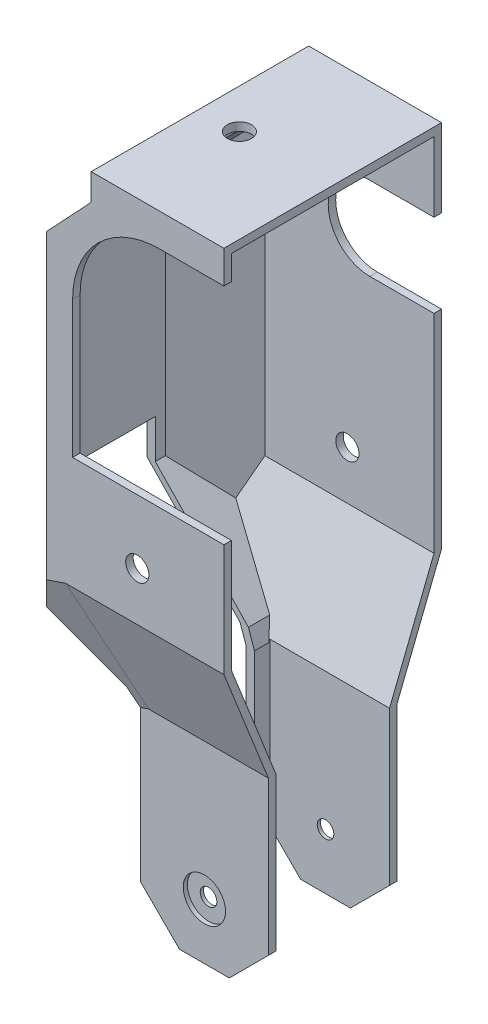
from build123d import *
from build123d.topology import SkipClean

# Parameters (mm, degrees)
EXTRUDE_1_DEPTH      = 1
SKETCH_2_W           = 14.000000000000007
SKETCH_2_H           = 24.219999999999995
SKETCH_2_R           = 1.45
SKETCH_2_H_2         = 1
EXTRUDE_2_DEPTH      = 1
SKETCH_3_R           = 1.4
CUT_EXTRUDE_1_DEPTH  = 50.06098246060713
EXTRUDE_3_DEPTH      = 25.22
EXTRUDE_4_DEPTH      = 1
CUT_EXTRUDE_2_DEPTH  = 0.1
EXTRUDE_5_REACH      = 56.514
EXTRUDE_6_DEPTH      = 4.7
EXTRUDE_7_DEPTH      = 6.26
CUT_EXTRUDE_3_DEPTH  = 54.61414092494707
CUT_EXTRUDE_4_REACH  = 50.47
EXTRUDE_8_REACH      = 53.244
CUT_EXTRUDE_6_DEPTH  = 0.721269738
SKETCH_15_R          = 1.000000000000005
EXTRUDE_9_DEPTH      = 1
EXTRUDE_START        = -1
EXTRUDE_10_DEPTH     = 1
CUT_EXTRUDE_7_DEPTH  = 0.1
CUT_EXTRUDE_10_REACH = 56.514
CUT_EXTRUDE_12_DEPTH = 51.10000000000001
EXTRUDE_START_2      = -2.75
EXTRUDE_11_DEPTH     = 2.75
CUT_EXTRUDE_13_REACH = 49.777
CUT_EXTRUDE_14_REACH = 49.777
EXTRUDE_12_DEPTH     = 2.75
EXTRUDE_13_REACH     = 50.829
CUT_EXTRUDE_15_REACH = 49.777
EXTRUDE_START_3      = -2.81831
EXTRUDE_14_DEPTH     = 2.81831
CUT_EXTRUDE_START    = -0.75
CUT_EXTRUDE_16_DEPTH = 0.75
CHAMFER_1_SIZE       = 0.8
CHAMFER_3_SIZE       = 6
EXTRUDE_15_DEPTH     = 1
EXTRUDE_16_DEPTH     = 1
CUT_EXTRUDE_17_DEPTH = 1
SKETCH_36_R          = 1.4000000000000001
CUT_EXTRUDE_18_DEPTH = 1
EXTRUDE_17_DEPTH     = 0.9
CUT_EXTRUDE_START_2  = -12.11
SKETCH_40_W          = 89.84282301383726
SKETCH_40_H          = 107.72029223205328
CUT_EXTRUDE_20_DEPTH = 12.11
CUT_EXTRUDE_22_DEPTH = 13.11
SKETCH_42_R          = 2.549999999999999
SKETCH_42_R_2        = 1.000000000000005
CUT_EXTRUDE_23_DEPTH = 0.5
CUT_EXTRUDE_START_3  = -0.5
SKETCH_43_R          = 2.549999999999998
CUT_EXTRUDE_24_DEPTH = 0.5


with BuildPart() as part:
    # 草图1 → 凸台-拉伸1 (new body)
    with BuildSketch(Plane.XY):
        with BuildLine():
            ThreePointArc((2.305000000000004, 21.64000000000001), (-2.7099999999999955, 26.655000000000012), (2.3050000000000055, 31.670000000000012))
            Line((2.305000000000005, 31.670000000000012), (9.040000000000003, 31.670000000000012))
            Line((9.040000000000003, 31.670000000000012), (9.040000000000003, 40.10000000000001))
            Line((9.040000000000003, 40.10000000000001), (-4.960000000000004, 40.10000000000001))
            Line((-4.960000000000004, 40.10000000000001), (-4.960000000000003, 37.50000000000002))
            Line((-4.960000000000003, 37.50000000000002), (-9.039999999999996, 33.15000000000001))
            Line((-9.039999999999996, 33.15000000000001), (-9.04, -3.3999999999999915))
            Line((-9.04, -3.3999999999999932), (9.040000000000003, -3.3999999999999932))
            Line((9.040000000000003, -3.3999999999999932), (9.040000000000003, 6.670384958363659))
            Line((9.040000000000003, 6.670384958363659), (9.040000000000003, 21.640000000000015))
            Line((9.040000000000003, 21.640000000000015), (2.305000000000005, 21.640000000000015))
        make_face()
    extrude(amount=EXTRUDE_1_DEPTH)

    # 草图2 → 凸台-拉伸2 (add)
    # profile 1 of 2: a face of its own
    with BuildSketch(Plane(origin=(0, 40.10000000000001, 0), x_dir=(1, 0, 0), z_dir=(0, 1, 0))):
        with Locations((2.039999999999999, 12.109999999999998)):
            Rectangle(SKETCH_2_W, SKETCH_2_H)
        with Locations(Location((-1.1999999999999935, 12.11, 0), (0, 0, 270))):
            Circle(SKETCH_2_R, mode=Mode.SUBTRACT)
    # profile 2 of 2: a face of its own
    with BuildSketch(Plane(origin=(0, 40.10000000000001, 0), x_dir=(1, 0, 0), z_dir=(0, 1, 0))):
        with Locations((2.039999999999999, -0.5)):
            Rectangle(SKETCH_2_W, SKETCH_2_H_2)
    extrude(amount=EXTRUDE_2_DEPTH)

    # 草图3 → 切除-拉伸1 (cut, through all)
    with BuildSketch(Plane.XY.offset(1)):
        with Locations((0.9999999999999981, 2.460000000000012)):
            Circle(SKETCH_3_R)
    extrude(amount=-CUT_EXTRUDE_1_DEPTH, mode=Mode.SUBTRACT)

    # 草图4 → 凸台-拉伸3 (add)
    with BuildSketch(Plane.XY.offset(1)):
        Polygon((-15.939999999999996, 25.793382352941165), (-15.939999999999996, 27.255138921743242), (-17.339999999999993, 25.762491862919703), (-17.339999999999996, 24.30073529411763), (-16.33999999999999, 25.366911764705875), align=None)
        Polygon((-16.33999999999999, 25.366911764705875), (-17.339999999999996, 24.30073529411763), (-17.339999999999996, 24.20000000000001), (-17.339999999999993, 1.3000000000000078), (-16.339999999999996, 1.3000000000000096), (-16.339999999999996, 24.20000000000001), align=None)
        Polygon((-4.960000000000004, 41.10000000000001), (-5.960000000000004, 41.10000000000001), (-5.960000000000004, 37.89558009821385), (-9.769380317724162, 33.834108435934404), (-15.93999999999999, 27.25513892174324), (-15.939999999999996, 25.793382352941165), (-9.039999999999996, 33.15000000000001), (-4.960000000000003, 37.50000000000002), align=None)
    extrude(amount=-EXTRUDE_3_DEPTH)

    # 草图5 → 凸台-拉伸4 (add)
    with BuildSketch(Plane.XY.offset(1)):
        Polygon((-16.339999999999993, 25.36691176470587), (-16.339999999999996, 1.3000000000000096), (-9.039999999999997, 1.3000000000000165), (-9.039999999999994, 33.15000000000001), align=None)
    extrude(amount=-EXTRUDE_4_DEPTH)

    # 草图6 → 切除-拉伸2 (cut)
    with BuildSketch(Plane(origin=(0, 0, 0), x_dir=(-1, 0, 0), z_dir=(0, 0, -1))):
        with BuildLine():
            Line((-2.305000000000006, 21.640000000000015), (-9.040000000000003, 21.640000000000015))
            Line((-9.040000000000003, 21.640000000000015), (-9.040000000000003, -3.3999999999999932))
            Line((-9.040000000000003, -3.3999999999999932), (9.04, -3.3999999999999932))
            Line((9.04, -3.3999999999999932), (9.04, 1.300000000000013))
            Line((9.04, 1.300000000000013), (16.339999999999996, 1.3000000000000096))
            Line((16.339999999999996, 1.3000000000000096), (16.339999999999993, 25.36691176470587))
            Line((16.339999999999993, 25.36691176470587), (4.959999999999999, 37.50000000000002))
            Line((4.959999999999999, 37.50000000000002), (4.960000000000004, 40.10000000000001))
            Line((4.960000000000004, 40.10000000000001), (-9.040000000000003, 40.10000000000001))
            Line((-9.040000000000003, 40.10000000000001), (-9.040000000000003, 31.670000000000012))
            Line((-9.040000000000003, 31.670000000000012), (-2.3050000000000046, 31.670000000000012))
            ThreePointArc((-2.3050000000000046, 31.670000000000012), (2.709999999999992, 26.655000000000012), (-2.305000000000006, 21.640000000000015))
        make_face()
    extrude(amount=-CUT_EXTRUDE_2_DEPTH, mode=Mode.SUBTRACT)

    # 凸台-拉伸5: up to this plane
    extrude_5_end = Plane(origin=(-9.127141339001065, -3.147290116896902, 0), z_dir=(0.9453729816262727, 0.3259906833194027, 0))
    # 草图7 → 凸台-拉伸5 (add, up to the surface)
    with BuildSketch(Plane(origin=(9.040000000000003, 0, 0), x_dir=(0, 0, -1), z_dir=(1, 0, 0)), mode=Mode.PRIVATE) as extrude_5_sk1:
        Polygon((-1, -3.3999999999999932), (4.359999999999999, -16.885), (5.26, -16.885), (-0.1, -3.3999999999999932), align=None)
    extrude_5_tool1 = split(extrude(extrude_5_sk1.sketch, amount=-EXTRUDE_5_REACH, mode=Mode.PRIVATE), bisect_by=extrude_5_end, keep=Keep.BOTH, mode=Mode.PRIVATE)
    add(extrude_5_tool1.solids().sort_by_distance((9.04, -10.1425, -2.13))[0])

    # 草图8 → 凸台-拉伸6 (add)
    with BuildSketch(Plane.XZ.offset(-1.300000000000013)):
        Polygon((-16.339999999999996, -24.22), (-16.339999999999996, 0.1), (-9.04, 0.10000000000000286), (-9.04, 1), (-17.339999999999993, 1), (-17.340000000000046, -24.22), align=None)
    extrude(amount=EXTRUDE_6_DEPTH)

    # 草图9 → 凸台-拉伸7 (add)
    with BuildSketch(Plane.XY.offset(1)):
        Polygon((-17.339999999999993, -3.399999999999995), (-4.390000000000023, -16.885), (-9.039999999999997, -3.3999999999999932), align=None)
    extrude(amount=-EXTRUDE_7_DEPTH)

    # 草图10 → 切除-拉伸3 (cut, through all)
    with BuildSketch(Plane(origin=(-9.127141339001064, -3.1472901168968996, 0), x_dir=(0, 0, -1), z_dir=(0.9453729816262728, 0.3259906833194025, 0))):
        Polygon((-1, -14.531523694987438), (4.359999999999999, -14.531523694987433), (-1, -0.2673123603219238), align=None)
    extrude(amount=-CUT_EXTRUDE_3_DEPTH, mode=Mode.SUBTRACT)

    # 切除-拉伸4: up to this face of the body (flat: up to its plane)
    cut_extrude_4_end = Plane(part.part.faces().sort_by_distance((1.105315773, -9.810831482, -2.448168835))[0])
    # 草图11 → 切除-拉伸4 (cut, up to the picked face)
    with BuildSketch(Plane(origin=(0, 0, -5.260000000000001), x_dir=(-1, 0, 0), z_dir=(0, 0, -1)), mode=Mode.PRIVATE) as cut_extrude_4_sk1:
        Polygon((4.390000000000023, -16.885000000000005), (17.340000000000007, -3.399999999999995), (16.339999999999996, -3.399999999999995), (9.039999999999997, -3.3999999999999932), align=None)
    cut_extrude_4_tool1 = split(extrude(cut_extrude_4_sk1.sketch, amount=-CUT_EXTRUDE_4_REACH, mode=Mode.PRIVATE), bisect_by=cut_extrude_4_end, keep=Keep.BOTH, mode=Mode.PRIVATE)
    add(cut_extrude_4_tool1.solids().sort_by(Axis((-10.256667, -7.895, -5.26), (0, 0, 1)))[0], mode=Mode.SUBTRACT)

    # 凸台-拉伸8: up to this face of the body (flat: up to its plane)
    extrude_8_end = Plane(part.part.faces().sort_by_distance((-9.568408076, -8.61169244, -0.786666667))[0])
    # 草图13 → 凸台-拉伸8 (add, up to the picked face)
    with BuildSketch(Plane(origin=(0, 0, -24.22), x_dir=(-1, 0, 0), z_dir=(0, 0, -1)), mode=Mode.PRIVATE) as extrude_8_sk1:
        Polygon((17.340000000000007, -3.399999999999997), (16.339999999999996, -3.399999999999995), (3.390000000000013, -16.885000000000005), (4.390000000000022, -16.885000000000005), align=None)
    extrude_8_tool1 = split(extrude(extrude_8_sk1.sketch, amount=-EXTRUDE_8_REACH, mode=Mode.PRIVATE), bisect_by=extrude_8_end, keep=Keep.BOTH, mode=Mode.PRIVATE)
    add(extrude_8_tool1.solids().sort_by(Axis((-10.365, -10.1425, -24.22), (0, 0, 1)))[0])

    # 草图14 → 切除-拉伸6 (cut)
    with BuildSketch(Plane(origin=(-10.199166727519122, -9.79452792891156, 0), x_dir=(0, 0, -1), z_dir=(0.7212697376131842, 0.6926542901068385, 0))):
        Polygon((-1, 9.558308282567797), (-2.0167175162547317, 9.558308282567797), (-1.8942214299589746, 8.865653992460917), (-1, 8.865653992460917), align=None)
        Polygon((-1, 8.865653992460917), (-1.8942214299589746, 8.865653992460917), (-1, 6.243844479321156), align=None)
    extrude(amount=-CUT_EXTRUDE_6_DEPTH, mode=Mode.SUBTRACT)

    # 草图15 → 凸台-拉伸9 (add)
    with BuildSketch(Plane.XY.offset(-5.36)):
        with BuildLine():
            Line((9.040000000000003, -33.385), (9.040000000000003, -16.885))
            Line((9.040000000000003, -16.885), (-4.390000000000019, -16.885000000000005))
            Line((-4.390000000000019, -16.885000000000005), (-4.390000000000003, -33.385))
            ThreePointArc((-4.390000000000003, -33.385), (2.324999999999993, -40.099999999999994), (9.040000000000003, -33.385))
        make_face()
        with Locations((2.3249999999998776, -33.3850000000001)):
            Circle(SKETCH_15_R, mode=Mode.SUBTRACT)
    extrude(amount=EXTRUDE_9_DEPTH)

    # 草图16 → 凸台-拉伸10 (add)
    with BuildSketch(Plane.XY.offset(-4.359999999999999).offset(EXTRUDE_START)):
        with BuildLine():
            Line((-4.390000000000003, -36.385), (-0.6750000000000043, -40.1))
            Line((-0.6750000000000042, -40.1), (2.32499999999999, -40.1))
            ThreePointArc((2.32499999999999, -40.1), (-2.423222035667676, -38.133222035667664), (-4.390000000000009, -33.385))
            Line((-4.390000000000009, -33.385), (-4.390000000000003, -36.385))
        make_face()
        with BuildLine():
            ThreePointArc((9.04, -33.385), (7.073222035667661, -38.13322203566767), (2.32499999999999, -40.1))
            Line((2.32499999999999, -40.1), (5.324999999999997, -40.1))
            Line((5.324999999999997, -40.1), (9.039999999999996, -36.385))
            Line((9.039999999999996, -36.385), (9.039999999999997, -33.385))
        make_face()
    extrude(amount=EXTRUDE_10_DEPTH)

    # 草图17 → 切除-拉伸7 (cut)
    with BuildSketch(Plane(origin=(0, 0, -5.36), x_dir=(-1, 0, 0), z_dir=(0, 0, -1))):
        Polygon((-5.324999999999997, -40.1), (0.6750000000000042, -40.1), (4.390000000000003, -36.385), (4.390000000000023, -16.885), (3.3900000000000112, -16.885000000000005), (-9.040000000000003, -16.885), (-9.039999999999996, -36.385), align=None)
    extrude(amount=-CUT_EXTRUDE_7_DEPTH, mode=Mode.SUBTRACT)

    # 切除-拉伸10: up to this face of the body (flat: up to its plane)
    cut_extrude_10_end = Plane(part.part.faces().sort_by_distance((-10.132298213, -9.864158965, -13.344682686))[0])
    # 草图18 → 切除-拉伸10 (cut, up to the picked face)
    with BuildSketch(Plane.ZY.offset(17.34000000000005), mode=Mode.PRIVATE) as cut_extrude_10_sk1:
        Polygon((-18.86, -16.885), (-24.22, -3.3999999999999932), (-24.22, -16.885000000000016), align=None)
    cut_extrude_10_tool1 = split(extrude(cut_extrude_10_sk1.sketch, amount=-CUT_EXTRUDE_10_REACH, mode=Mode.PRIVATE), bisect_by=cut_extrude_10_end, keep=Keep.BOTH, mode=Mode.PRIVATE)
    add(cut_extrude_10_tool1.solids().sort_by(Axis((-17.34, -12.39, -22.433333), (1, -2.22e-15, 0)))[0], mode=Mode.SUBTRACT)

    # 草图20 → 切除-拉伸12 (cut)
    with BuildSketch(Plane.ZY.offset(17.34000000000005)):
        Polygon((-7.109999999999996, -3.4000000000000106), (-16.109999999999996, -3.400000000000023), (-16.109999999999992, -16.885000000000012), (-7.109999999999994, -16.885000000000012), align=None)
        Polygon((-7.109999999999994, -16.885000000000012), (-16.109999999999996, -16.885000000000005), (-16.109999999999992, -19.987970333282604), (-7.109999999999992, -19.987970333282604), align=None)
        Polygon((-14.919999999999998, 1.3000000000000096), (-16.109999999999996, 1.3000000000000096), (-16.109999999999996, -3.400000000000033), (-7.109999999999996, -3.4000000000000106), (-7.109999999999997, 1.3000000000000107), align=None)
    extrude(amount=-CUT_EXTRUDE_12_DEPTH, mode=Mode.SUBTRACT)

    # 草图22 → 凸台-拉伸11 (add)
    with BuildSketch(Plane.XY.offset(-4.359999999999999).offset(EXTRUDE_START_2)):
        Polygon((-5.390000000000022, -15.843687258687254), (-5.390000000000019, -16.885000000000005), (-5.3900000000000166, -35.384999999999984), (-4.390000000000003, -36.385), (-4.390000000000019, -16.885000000000005), align=None)
    extrude(amount=EXTRUDE_11_DEPTH)

    # 切除-拉伸13: up to this plane
    cut_extrude_13_end = Plane(origin=(-22.011711829773798, -0.4982010551356256, 1.2534032142731184), z_dir=(0, -0.36936995412553747, 0.9292824312281485))
    # 草图23 → 切除-拉伸13 (cut, up to the surface)
    with BuildSketch(Plane(origin=(0, -1.16e-15, -7.109999999999997), x_dir=(-1, 0, 0), z_dir=(0, -1.6e-16, -1)), mode=Mode.PRIVATE) as cut_extrude_13_sk1:
        Polygon((3.3900000000000112, -16.88499999999999), (4.390000000000031, -16.884999999999987), (4.950240963855443, -15.260301204819266), align=None)
    cut_extrude_13_tool1 = split(extrude(cut_extrude_13_sk1.sketch, amount=-CUT_EXTRUDE_13_REACH, mode=Mode.PRIVATE), bisect_by=cut_extrude_13_end, keep=Keep.BOTH, mode=Mode.PRIVATE)
    add(cut_extrude_13_tool1.solids().sort_by_distance((-4.243414, -16.343434, -7.11))[0], mode=Mode.SUBTRACT)

    # 切除-拉伸14: up to this plane
    cut_extrude_14_end = Plane(origin=(-22.011711829773798, -0.4982010551356256, 1.2534032142731184), z_dir=(0, -0.36936995412553747, 0.9292824312281485))
    # 草图25 → 切除-拉伸14 (cut, up to the surface)
    with BuildSketch(Plane(origin=(0, -1.16e-15, -7.109999999999997), x_dir=(-1, 0, 0), z_dir=(0, -1.6e-16, -1)), mode=Mode.PRIVATE) as cut_extrude_14_sk1:
        Polygon((4.484537298162646, -16.917599068331942), (5.044778262018067, -15.292900273151215), (5.115280688300644, -15.088443236931736), (4.950240963855439, -15.260301204819275), (4.390000000000019, -16.885000000000005), (4.390000000000019, -17.191757233003564), align=None)
    cut_extrude_14_tool1 = split(extrude(cut_extrude_14_sk1.sketch, amount=-CUT_EXTRUDE_14_REACH, mode=Mode.PRIVATE), bisect_by=cut_extrude_14_end, keep=Keep.BOTH, mode=Mode.PRIVATE)
    add(cut_extrude_14_tool1.solids().sort_by_distance((-4.713146, -16.107819, -7.11))[0], mode=Mode.SUBTRACT)

    # 草图26 → 凸台-拉伸12 (add)
    with BuildSketch(Plane(origin=(0, -1.16e-15, -7.109999999999997), x_dir=(-1, 0, 0), z_dir=(0, -1.6e-16, -1))):
        Polygon((5.390000000000022, -15.843687258687257), (5.390000000000022, -17.191757233003564), (6.115280688300655, -15.088443236931735), align=None)
    extrude(amount=-EXTRUDE_12_DEPTH)

    # 凸台-拉伸13: up to this face of the body (flat: up to its plane)
    extrude_13_end = Plane(part.part.faces().sort_by_distance((-9.568408076, -8.61169244, -0.786666667))[0])
    # 草图27 → 凸台-拉伸13 (add, up to the picked face)
    with BuildSketch(Plane.XY.offset(-4.359999999999999), mode=Mode.PRIVATE) as extrude_13_sk1:
        Polygon((-4.390000000000019, -16.885000000000005), (-5.390000000000021, -17.19175723300357), (-6.115280688300651, -15.088443236931742), align=None)
    extrude_13_tool1 = split(extrude(extrude_13_sk1.sketch, amount=EXTRUDE_13_REACH, mode=Mode.PRIVATE), bisect_by=extrude_13_end, keep=Keep.BOTH, mode=Mode.PRIVATE)
    add(extrude_13_tool1.solids().sort_by(Axis((-5.298427, -16.3884, -4.36), (0, 0, 1)))[0])

    # 切除-拉伸15: up to this plane
    cut_extrude_15_end = Plane(origin=(7.450077950019115, -8.77736715203255, -22.08261120245499), z_dir=(0, -0.36936995412553747, -0.9292824312281485))
    # 草图28 → 切除-拉伸15 (cut, up to the surface)
    with BuildSketch(Plane.XY.offset(-16.109999999999996), mode=Mode.PRIVATE) as cut_extrude_15_sk1:
        Polygon((-5.115280688300643, -15.088443236931733), (-4.555039724445227, -16.71314203211245), (-4.390000000000022, -16.884999999999998), (-3.3900000000000103, -16.885000000000005), align=None)
    cut_extrude_15_tool1 = split(extrude(cut_extrude_15_sk1.sketch, amount=-CUT_EXTRUDE_15_REACH, mode=Mode.PRIVATE), bisect_by=cut_extrude_15_end, keep=Keep.BOTH, mode=Mode.PRIVATE)
    add(cut_extrude_15_tool1.solids().sort_by_distance((-4.332333, -16.281146, -16.11))[0], mode=Mode.SUBTRACT)

    # 草图29 → 凸台-拉伸14 (add)
    with BuildSketch(Plane.XY.offset(-16.109999999999996).offset(EXTRUDE_START_3)):
        Polygon((-4.390000000000019, -17.19175723300356), (-4.555039724445218, -16.71314203211248), (-6.115280688300654, -15.088443236931742), (-5.390000000000018, -17.191757233003575), (-5.3900000000000166, -35.384999999999984), (-4.389999999999998, -36.38500000000001), align=None)
    extrude(amount=EXTRUDE_14_DEPTH)

    # 草图30 → 切除-拉伸16 (cut)
    with BuildSketch(Plane.XY.offset(-16.109999999999996).offset(CUT_EXTRUDE_START)):
        Polygon((-6.115280688300638, -15.088443236931745), (-5.1152806883006665, -15.088443236931706), (-4.390000000000019, -17.191757233003564), (-4.389999999999998, -36.38500000000001), (-5.3900000000000166, -35.384999999999984), (-5.390000000000017, -17.191757233003575), align=None)
    extrude(amount=CUT_EXTRUDE_16_DEPTH, mode=Mode.SUBTRACT)

    # 倒角1
    # the kernel refuses this chamfer: 0.8 mm, written as the material it takes off along each edge
    with BuildSketch(Plane(origin=(-8.17262707867337, -15.088443236931827, -16.109999999999992), x_dir=(-3.906507503623607e-14, 0.9996219169112966, 0.027495876610587302), z_dir=(1, 3.908e-14, 0))) as chamfer_1_piece_1_section:
        Polygon((CHAMFER_1_SIZE * 0.999621916911, -CHAMFER_1_SIZE * 0.0274958766106), (-CHAMFER_1_SIZE * 0.0274958766106, -CHAMFER_1_SIZE * 0.999621916911), (0, 0), align=None)
    chamfer_1_piece_1 = extrude(amount=5.114692780745436, mode=Mode.PRIVATE)
    chamfer_1_piece_1 = split(chamfer_1_piece_1, bisect_by=Plane(origin=(-5.615280688300567, -14.821822785366846, -16.859999999999996), z_dir=(0, 0, 1)), keep=Keep.TOP, mode=Mode.PRIVATE)
    add(chamfer_1_piece_1, mode=Mode.SUBTRACT)

    # 倒角3
    chamfer_3_edges = [part.edges().sort_by_distance(p)[0] for p in [
        (-17.339999999999993, 11.181245931459856, 1),
        (-16.339999999999996, 10.983455882352938, 0.1),
    ]]
    chamfer(chamfer_3_edges, length=CHAMFER_3_SIZE)

    # 草图32 → 凸台-拉伸15 (add)
    with BuildSketch(Plane(origin=(0, 0, -24.22), x_dir=(-1, 0, 0), z_dir=(0, 0, -1))):
        Polygon((10.539999999999964, -3.3999999999999932), (16.339999999999996, -3.399999999999995), (16.339999999999996, 25.36691176470587), (10.53999999999996, 31.550735294117693), align=None)
    extrude(amount=-EXTRUDE_15_DEPTH)

    # 草图33 → 凸台-拉伸16 (add)
    with BuildSketch(Plane(origin=(9.040000000000003, 0, 0), x_dir=(0, 0, -1), z_dir=(1, 0, 0))):
        Polygon((5.26, -36.385), (5.26, -16.885), (-0.1, -3.3999999999999932), (-0.1, 21.640000000000015), (-1, 21.640000000000015), (-1, -3.3999999999999932), (4.359999999999999, -16.885), (4.359999999999999, -36.385), align=None)
        Polygon((-0.1, 31.670000000000012), (-0.1, 40.10000000000001), (24.22, 40.10000000000001), (24.22, 41.10000000000001), (-1, 41.10000000000001), (-1, 31.670000000000012), align=None)
    extrude(amount=EXTRUDE_16_DEPTH)

    # 草图34 → 切除-拉伸17 (cut)
    with BuildSketch(Plane.XY.offset(-4.359999999999999)):
        Polygon((10.040000000000004, -35.384999999999984), (9.040000000000003, -36.385), (10.040000000000004, -36.385), align=None)
    extrude(amount=-CUT_EXTRUDE_17_DEPTH, mode=Mode.SUBTRACT)

    # 草图36 → 切除-拉伸18 (cut)
    with BuildSketch(Plane.XY.offset(1)):
        with Locations((-0.4000000000000017, 2.460000000000012)):
            Circle(SKETCH_36_R)
    extrude(amount=-CUT_EXTRUDE_18_DEPTH, mode=Mode.SUBTRACT)

    # 草图37 → 凸台-拉伸17 (add)
    with SkipClean():  # the faces are left unmerged after this step: merging them gives an invalid solid
        with BuildSketch(Plane.XY.offset(1)):
            with BuildLine():
                ThreePointArc((0.9999999999999982, 2.4600000000000115), (0.8124355652982125, 1.7600000000000122), (0.29999999999999805, 1.2475644347017973))
                ThreePointArc((0.2999999999999984, 1.2475644347017978), (1.6999999999999982, 1.247564434701798), (2.3999999999999986, 2.460000000000012))
                ThreePointArc((2.3999999999999986, 2.460000000000012), (1.6999999999999988, 3.672435565298226), (0.29999999999999905, 3.6724355652982275))
                ThreePointArc((0.29999999999999805, 3.6724355652982266), (0.8124355652982123, 3.160000000000012), (0.9999999999999982, 2.460000000000012))
            make_face()
        extrude(amount=-EXTRUDE_17_DEPTH)

    # 草图40 → 切除-拉伸20 (cut)
    with SkipClean():  # the faces are left unmerged after this step: merging them gives an invalid solid
        with BuildSketch(Plane(origin=(0, 0, -24.22), x_dir=(-1, 0, 0), z_dir=(0, 0, -1)).offset(CUT_EXTRUDE_START_2)):
            with Locations((0.15490000207892152, -1.4990762577480474)):
                Rectangle(SKETCH_40_W, SKETCH_40_H)
        extrude(amount=CUT_EXTRUDE_20_DEPTH, mode=Mode.SUBTRACT)

    # 镜向1: part across plane


with BuildPart() as part_1:
    with SkipClean():  # the faces are left unmerged after this step: merging them gives an invalid solid
        add(part.part)
        add(part.part.mirror(Plane.XY.offset(-12.11)))

    # 草图41 → 切除-拉伸22 (cut)
    with SkipClean():  # the faces are left unmerged after this step: merging them gives an invalid solid
        with BuildSketch(Plane.XY.offset(-12.11)):
            with BuildLine():
                Line((10.040000000000004, 37.155000000000015), (2.305000000000005, 37.155000000000015))
                ThreePointArc((2.3050000000000055, 37.155000000000015), (6.529498334560102, 36.26767984597943), (10.039999999999905, 33.7556883469141))
                Line((10.040000000000004, 33.755688346914134), (10.040000000000004, 37.155000000000015))
            make_face()
            with BuildLine():
                ThreePointArc((10.039999999999905, 33.7556883469141), (6.529498334560102, 36.26767984597943), (2.3050000000000055, 37.155000000000015))
                Line((2.305000000000005, 37.155000000000015), (2.3050000000000055, 31.670000000000016))
                Line((2.3050000000000055, 31.670000000000012), (10.040000000000004, 31.670000000000012))
                Line((10.040000000000004, 31.670000000000012), (10.040000000000004, 33.755688346914134))
            make_face()
            with BuildLine():
                Line((2.3050000000000055, 31.670000000000016), (2.305000000000005, 37.155000000000015))
                ThreePointArc((2.3050000000000055, 37.155000000000015), (-5.1196212024587435, 34.07962120245876), (-8.194999999999995, 26.655000000000012))
                Line((-8.194999999999995, 26.655000000000012), (-2.7099999999999955, 26.655000000000012))
                ThreePointArc((-2.7099999999999955, 26.65499999999993), (-1.2411405076505608, 30.20114050765052), (2.3050000000000055, 31.670000000000016))
            make_face()
            with BuildLine():
                Line((-2.7099999999999955, 26.655000000000012), (-8.194999999999995, 26.655000000000012))
                ThreePointArc((-8.194999999999995, 26.655000000000012), (-5.11962120245862, 19.23037879754114), (2.3050000000003577, 16.155000000000012))
                Line((2.3050000000000064, 16.155000000000012), (2.305000000000006, 21.640000000000015))
                ThreePointArc((2.305000000000005, 21.640000000000015), (-1.2411405076505009, 23.10885949234945), (-2.7099999999999955, 26.65499999999993))
            make_face()
            with BuildLine():
                Line((2.3050000000000055, 31.670000000000016), (2.305000000000005, 37.155000000000015))
                ThreePointArc((2.3050000000000055, 37.155000000000015), (-5.1196212024587435, 34.07962120245876), (-8.194999999999995, 26.655000000000012))
                Line((-8.194999999999995, 26.655000000000012), (-2.7099999999999955, 26.655000000000012))
                ThreePointArc((-2.7099999999999955, 26.65499999999993), (-1.2411405076505608, 30.20114050765052), (2.3050000000000055, 31.670000000000016))
            make_face()
            with BuildLine():
                Line((-2.7099999999999955, 26.655000000000012), (-8.194999999999995, 26.655000000000012))
                ThreePointArc((-8.194999999999995, 26.655000000000012), (-5.11962120245862, 19.23037879754114), (2.3050000000003577, 16.155000000000012))
                Line((2.3050000000000064, 16.155000000000012), (2.305000000000006, 21.640000000000015))
                ThreePointArc((2.305000000000005, 21.640000000000015), (-1.2411405076505009, 23.10885949234945), (-2.7099999999999955, 26.65499999999993))
            make_face()
            with BuildLine():
                Line((2.305000000000006, 21.640000000000015), (2.3050000000000064, 16.155000000000012))
                ThreePointArc((2.3050000000003577, 16.155000000000012), (6.52949833456033, 17.04232015402069), (10.04000000000001, 19.55431165308604))
                Line((10.040000000000004, 19.55431165308604), (10.040000000000004, 21.640000000000015))
                Line((10.040000000000004, 21.640000000000015), (2.305000000000005, 21.640000000000015))
            make_face()
            with BuildLine():
                ThreePointArc((10.04000000000001, 19.55431165308604), (6.52949833456033, 17.04232015402069), (2.3050000000003577, 16.155000000000012))
                Line((2.3050000000000064, 16.155000000000012), (2.305000000000007, 10.155000000000015))
                Line((2.305000000000007, 10.155000000000015), (10.040000000000006, 10.155000000000015))
                Line((10.040000000000004, 10.155000000000015), (10.040000000000004, 19.55431165308604))
            make_face()
            with BuildLine():
                ThreePointArc((2.3050000000003577, 16.155000000000012), (-5.11962120245862, 19.23037879754114), (-8.194999999999995, 26.655000000000012))
                Line((-8.194999999999995, 26.655000000000012), (-8.194999999999993, 10.155000000000015))
                Line((-8.194999999999993, 10.155000000000015), (2.305000000000007, 10.155000000000015))
                Line((2.305000000000007, 10.155000000000015), (2.3050000000000064, 16.155000000000012))
            make_face()
        extrude(amount=CUT_EXTRUDE_22_DEPTH, mode=Mode.SUBTRACT)

    # 草图42 → 切除-拉伸23 (cut)
    with SkipClean():  # the faces are left unmerged after this step: merging them gives an invalid solid
        with BuildSketch(Plane(origin=(0, 0, -19.86), x_dir=(-1, 0, 0), z_dir=(0, 0, -1))):
            with Locations((-2.3249999999998776, -33.3850000000001)):
                Circle(SKETCH_42_R)
            with Locations((-2.3249999999998776, -33.3850000000001)):
                Circle(SKETCH_42_R_2, mode=Mode.SUBTRACT)
        extrude(amount=-CUT_EXTRUDE_23_DEPTH, mode=Mode.SUBTRACT)

    # 草图43 → 切除-拉伸24 (cut)
    with SkipClean():  # the faces are left unmerged after this step: merging them gives an invalid solid
        with BuildSketch(Plane.XY.offset(-4.359999999999999).offset(CUT_EXTRUDE_START_3)):
            with Locations(Location((2.3249999999998776, -33.3850000000001, 0), (0, 0, 180))):
                Circle(SKETCH_43_R)
        extrude(amount=CUT_EXTRUDE_24_DEPTH, mode=Mode.SUBTRACT)


solid = part_1.part
